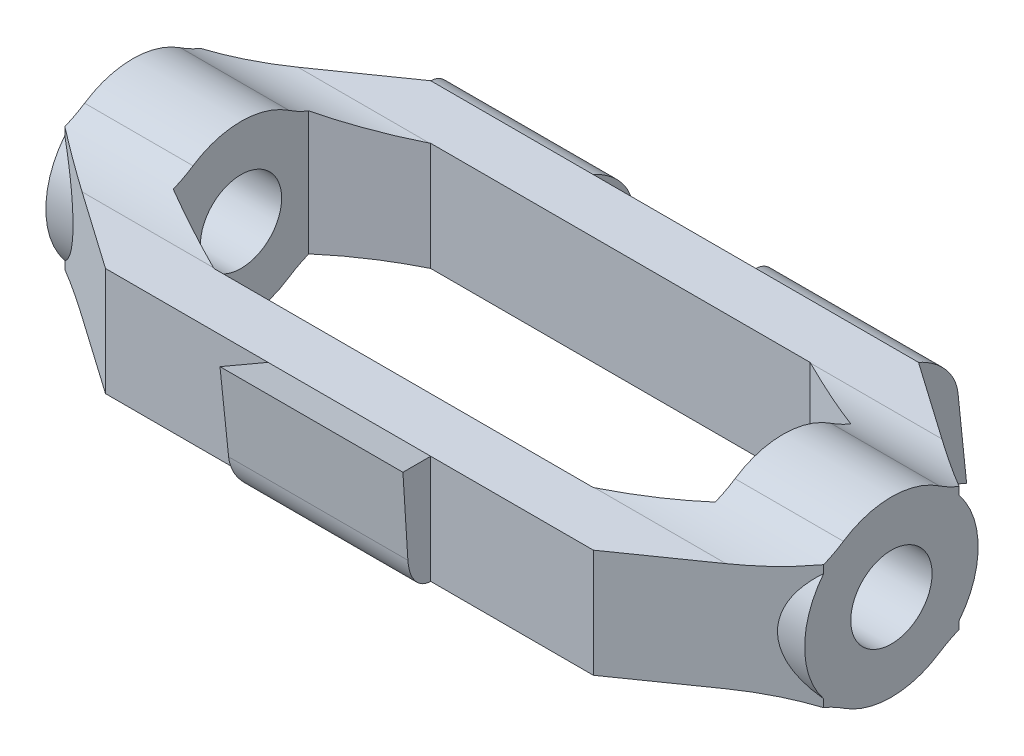
from build123d import *

# Parameters (mm, degrees)
RESSALTO_EXTRUS_O1_DEPTH           = 10
RESSALTO_EXTRUS_O1_2_DEPTH         = 10
ESBO_O2_R                          = 16.007810594
ESBO_O2_R_2                        = 7.5
RESSALTO_EXTRUS_O2_DEPTH           = 20
FILETE1_R                          = 20
ESBO_O3_W                          = 30
ESBO_O3_H                          = 20
RESSALTO_EXTRUS_O3_DEPTH           = 7
RESSALTO_EXTRUS_O3_DRAFT           = -15
ESBO_O4_W                          = 30
ESBO_O4_H                          = 20
RESSALTO_EXTRUS_O4_DEPTH           = 7
RESSALTO_EXTRUS_O4_DRAFT           = -15
RESSALTO_EXTRUS_O4_PROFILE_2_DEPTH = 7
RESSALTO_EXTRUS_O4_PROFILE_2_DRAFT = -15
CORTE_EXTRUS_O1_DEPTH              = 16.88
CORTE_EXTRUS_O2_DEPTH              = 46.88
FILETE4_R                          = 8


with BuildPart() as part:
    # Esboço1 → Ressalto-extrusão1 (new, symmetric)
    with BuildSketch(Plane(origin=(0, 0, 0), x_dir=(1, 0, 0), z_dir=(0, 1, 0))):
        Polygon((45, -30), (70, -12.5), (50, -12.5), (35, -20), (-35, -20), (-50, -12.5), (-70, -12.5), (-45, -30), align=None)
    extrude(amount=RESSALTO_EXTRUS_O1_DEPTH, both=True)



with BuildPart() as body_2:
    # Esboço1 → Ressalto-extrus_o1 2 (new, symmetric)
    with BuildSketch(Plane(origin=(0, 0, 0), x_dir=(1, 0, 0), z_dir=(0, 1, 0))):
        Polygon((70, 12.5), (50, 12.5), (35, 20), (-35, 20), (-50, 12.5), (-70, 12.5), (-45, 30), (45, 30), align=None)
    extrude(amount=RESSALTO_EXTRUS_O1_2_DEPTH, both=True)


with BuildPart() as part_1:
    add(part.part)

    add(body_2.part)  # Ressalto-extrusão2 merges body 2
    # Esboço2 → Ressalto-extrusão2 (add)
    with BuildSketch(Plane(origin=(-50, 0, 0), x_dir=(0, 0, -1), z_dir=(1, 0, 0))):
        Circle(ESBO_O2_R)
        Circle(ESBO_O2_R_2, mode=Mode.SUBTRACT)
    ressalto_extrus_o2 = extrude(amount=-RESSALTO_EXTRUS_O2_DEPTH)

    # Espelhar1: Ressalto-extrusão2 across plane
    add(ressalto_extrus_o2.mirror(Plane(origin=(0, 0, 0), x_dir=(0, 0, 1), z_dir=(1, 0, 0))))

    # Filete1
    # the kernel refuses this fillet: 20 mm, written as the material it adds along each edge
    with BuildSketch(Plane(origin=(70, -10, 12.5), x_dir=(0, 0, 1), z_dir=(-1, 0, 0))) as filete1_piece_1_section:
        with BuildLine():
            CenterArc((7.413875156, -20), FILETE1_R, 90, 33.576041437)
            ThreePointArc((-3.646989044, -3.336948565), (-1.693910252, -1.810098405), (0, 0))
            Line((0, 0), (7.413875156, 0))
        make_face()
    filete1_piece_1 = extrude(amount=20, mode=Mode.PRIVATE)
    filete1_piece_1 = split(filete1_piece_1, bisect_by=Plane(origin=(62.463989949, -10.639640977, 17.775207036), z_dir=(-0.5734623443633283, 0, -0.8192319205190406)), keep=Keep.TOP, mode=Mode.PRIVATE)
    filete1_piece_1 = split(filete1_piece_1, bisect_by=Plane(origin=(57.171735223, -10.639640977, 8.914132389), z_dir=(0.4472135954999588, 0, 0.8944271909999154)), keep=Keep.TOP, mode=Mode.PRIVATE)
    add(filete1_piece_1)
    with BuildSketch(Plane(origin=(70, -10, 12.5), x_dir=(0, 0, 1), z_dir=(-1, 0, 0))) as filete1_piece_2_section:
        with BuildLine():
            CenterArc((7.413875156, -20), FILETE1_R, 90, 33.576041437)
            ThreePointArc((-3.646989044, -3.336948565), (-1.693910252, -1.810098405), (0, 0))
            Line((0, 0), (7.413875156, 0))
        make_face()
    filete1_piece_2 = extrude(amount=20, mode=Mode.PRIVATE)
    filete1_piece_2 = split(filete1_piece_2, bisect_by=Plane(origin=(52.590686854, -12.043119704, 11.204656573), z_dir=(-0.4472135954999588, 0, -0.8944271909999154)), keep=Keep.TOP, mode=Mode.PRIVATE)
    add(filete1_piece_2)
    with BuildSketch(Plane(origin=(70, -10, 12.5), x_dir=(0, 0, 1), z_dir=(-1, 0, 0))) as filete1_piece_3_section:
        with BuildLine():
            CenterArc((7.413875156, -20), FILETE1_R, 90, 33.576041437)
            ThreePointArc((-3.646989044, -3.336948565), (-1.693910252, -1.810098405), (0, 0))
            Line((0, 0), (7.413875156, 0))
        make_face()
    filete1_piece_3 = extrude(amount=38.534687891, mode=Mode.PRIVATE)
    filete1_piece_3 = split(filete1_piece_3, bisect_by=Plane(origin=(44.945861579, -9.976895513, 15.027069211), z_dir=(0.4472135954999588, 0, 0.8944271909999154)), keep=Keep.TOP, mode=Mode.PRIVATE)
    filete1_piece_3 = split(filete1_piece_3, bisect_by=Plane(origin=(50, -9.976895513, 16.711782017), z_dir=(-1, 0, 0)), keep=Keep.TOP, mode=Mode.PRIVATE)
    add(filete1_piece_3)
    with BuildSketch(Plane(origin=(-31.465312109, 10, 12.5), x_dir=(0, 0.6750510749314106, -0.7377709985042425), z_dir=(-1, 0, 0))) as filete1_piece_4_section:
        with BuildLine():
            CenterArc((8.031279422, -19.760164364), FILETE1_R, 98.882075154, 33.576041437)
            Line((-5.469742077, -5.004744394), (0, 0))
            ThreePointArc((0, 0), (2.471626732, -0.191962172), (4.943253464, 0))
        make_face()
    filete1_piece_4 = extrude(amount=38.534687891, mode=Mode.PRIVATE)
    filete1_piece_4 = split(filete1_piece_4, bisect_by=Plane(origin=(-50, 9.976895512, 16.711782019), z_dir=(1, 0, 0)), keep=Keep.TOP, mode=Mode.PRIVATE)
    filete1_piece_4 = split(filete1_piece_4, bisect_by=Plane(origin=(-44.945861578, 9.976895512, 15.027069211), z_dir=(-0.4472135954999591, 0, 0.8944271909999153)), keep=Keep.TOP, mode=Mode.PRIVATE)
    add(filete1_piece_4)
    with BuildSketch(Plane(origin=(-50, 10, 12.5), x_dir=(0, 0.6750510749314104, -0.7377709985042427), z_dir=(-1, 0, 0))) as filete1_piece_5_section:
        with BuildLine():
            CenterArc((8.031279422, -19.760164364), FILETE1_R, 98.882075154, 33.576041437)
            Line((-5.469742077, -5.004744394), (0, 0))
            ThreePointArc((0, 0), (2.471626732, -0.191962172), (4.943253464, 0))
        make_face()
    filete1_piece_5 = extrude(amount=20, mode=Mode.PRIVATE)
    filete1_piece_5 = split(filete1_piece_5, bisect_by=Plane(origin=(-52.590686846, 12.043119705, 11.204656577), z_dir=(0.4472135954999591, 0, -0.8944271909999153)), keep=Keep.TOP, mode=Mode.PRIVATE)
    add(filete1_piece_5)
    with BuildSketch(Plane(origin=(-50, 10, 12.5), x_dir=(0, 0.6750510749314104, -0.7377709985042427), z_dir=(-1, 0, 0))) as filete1_piece_6_section:
        with BuildLine():
            CenterArc((8.031279422, -19.760164364), FILETE1_R, 98.882075154, 33.576041437)
            Line((-5.469742077, -5.004744394), (0, 0))
            ThreePointArc((0, 0), (2.471626732, -0.191962172), (4.943253464, 0))
        make_face()
    filete1_piece_6 = extrude(amount=20, mode=Mode.PRIVATE)
    filete1_piece_6 = split(filete1_piece_6, bisect_by=Plane(origin=(-62.463989948, 10.639640977, 17.775207036), z_dir=(0.5734623443633283, 0, -0.8192319205190406)), keep=Keep.TOP, mode=Mode.PRIVATE)
    filete1_piece_6 = split(filete1_piece_6, bisect_by=Plane(origin=(-57.171735222, 10.639640977, 8.914132389), z_dir=(-0.4472135954999591, 0, 0.8944271909999153)), keep=Keep.TOP, mode=Mode.PRIVATE)
    add(filete1_piece_6)
    with BuildSketch(Plane(origin=(70, 10, -12.5), x_dir=(0, 0.67505107493141, 0.737770998504243), z_dir=(-1, 0, 0))) as filete1_piece_7_section:
        with BuildLine():
            CenterArc((8.031279422, 19.760164364), FILETE1_R, 227.541883409, 33.576041437)
            Line((-5.469742077, 5.004744394), (0, 0))
            ThreePointArc((0, 0), (2.471626732, 0.191962172), (4.943253464, 0))
        make_face()
    filete1_piece_7 = extrude(amount=20, mode=Mode.PRIVATE)
    filete1_piece_7 = split(filete1_piece_7, bisect_by=Plane(origin=(57.171735222, 10.639640977, -8.914132389), z_dir=(0.44721359549995815, 0, -0.8944271909999159)), keep=Keep.TOP, mode=Mode.PRIVATE)
    filete1_piece_7 = split(filete1_piece_7, bisect_by=Plane(origin=(62.463989948, 10.639640977, -17.775207036), z_dir=(-0.5734623443633284, 0, 0.8192319205190405)), keep=Keep.TOP, mode=Mode.PRIVATE)
    add(filete1_piece_7)
    with BuildSketch(Plane(origin=(70, 10, -12.5), x_dir=(0, 0.67505107493141, 0.737770998504243), z_dir=(-1, 0, 0))) as filete1_piece_8_section:
        with BuildLine():
            CenterArc((8.031279422, 19.760164364), FILETE1_R, 227.541883409, 33.576041437)
            Line((-5.469742077, 5.004744394), (0, 0))
            ThreePointArc((0, 0), (2.471626732, 0.191962172), (4.943253464, 0))
        make_face()
    filete1_piece_8 = extrude(amount=38.534687891, mode=Mode.PRIVATE)
    filete1_piece_8 = split(filete1_piece_8, bisect_by=Plane(origin=(44.945861578, 9.976895512, -15.027069211), z_dir=(0.44721359549995815, 0, -0.8944271909999159)), keep=Keep.TOP, mode=Mode.PRIVATE)
    filete1_piece_8 = split(filete1_piece_8, bisect_by=Plane(origin=(50, 9.976895512, -16.711782019), z_dir=(-1, 0, 0)), keep=Keep.TOP, mode=Mode.PRIVATE)
    add(filete1_piece_8)
    with BuildSketch(Plane(origin=(70, 10, -12.5), x_dir=(0, 0.67505107493141, 0.737770998504243), z_dir=(-1, 0, 0))) as filete1_piece_9_section:
        with BuildLine():
            CenterArc((8.031279422, 19.760164364), FILETE1_R, 227.541883409, 33.576041437)
            Line((-5.469742077, 5.004744394), (0, 0))
            ThreePointArc((0, 0), (2.471626732, 0.191962172), (4.943253464, 0))
        make_face()
    filete1_piece_9 = extrude(amount=20, mode=Mode.PRIVATE)
    filete1_piece_9 = split(filete1_piece_9, bisect_by=Plane(origin=(52.590686846, 12.043119705, -11.204656577), z_dir=(-0.44721359549995815, 0, 0.8944271909999159)), keep=Keep.TOP, mode=Mode.PRIVATE)
    add(filete1_piece_9)
    with BuildSketch(Plane(origin=(-50, 10, -12.5), x_dir=(0, 0, -1), z_dir=(-1, 0, 0))) as filete1_piece_10_section:
        with BuildLine():
            CenterArc((7.413875156, -20), FILETE1_R, 90, 33.576041437)
            ThreePointArc((-3.646989044, -3.336948565), (-1.693910252, -1.810098405), (0, 0))
            Line((0, 0), (7.413875156, 0))
        make_face()
    filete1_piece_10 = extrude(amount=20, mode=Mode.PRIVATE)
    filete1_piece_10 = split(filete1_piece_10, bisect_by=Plane(origin=(-52.590686854, 12.043119704, -11.204656573), z_dir=(0.44721359549995776, 0, 0.894427190999916)), keep=Keep.TOP, mode=Mode.PRIVATE)
    add(filete1_piece_10)
    with BuildSketch(Plane(origin=(-31.465312109, 10, -12.5), x_dir=(0, 0, -1), z_dir=(-1, 0, 0))) as filete1_piece_11_section:
        with BuildLine():
            CenterArc((7.413875156, -20), FILETE1_R, 90, 33.576041437)
            ThreePointArc((-3.646989044, -3.336948565), (-1.693910252, -1.810098405), (0, 0))
            Line((0, 0), (7.413875156, 0))
        make_face()
    filete1_piece_11 = extrude(amount=38.534687891, mode=Mode.PRIVATE)
    filete1_piece_11 = split(filete1_piece_11, bisect_by=Plane(origin=(-50, 9.976895513, -16.711782017), z_dir=(1, 0, 0)), keep=Keep.TOP, mode=Mode.PRIVATE)
    filete1_piece_11 = split(filete1_piece_11, bisect_by=Plane(origin=(-44.945861579, 9.976895513, -15.027069211), z_dir=(-0.44721359549995776, 0, -0.894427190999916)), keep=Keep.TOP, mode=Mode.PRIVATE)
    add(filete1_piece_11)
    with BuildSketch(Plane(origin=(-50, 10, -12.5), x_dir=(0, 0, -1), z_dir=(-1, 0, 0))) as filete1_piece_12_section:
        with BuildLine():
            CenterArc((7.413875156, -20), FILETE1_R, 90, 33.576041437)
            ThreePointArc((-3.646989044, -3.336948565), (-1.693910252, -1.810098405), (0, 0))
            Line((0, 0), (7.413875156, 0))
        make_face()
    filete1_piece_12 = extrude(amount=20, mode=Mode.PRIVATE)
    filete1_piece_12 = split(filete1_piece_12, bisect_by=Plane(origin=(-57.171735223, 10.639640977, -8.914132389), z_dir=(-0.44721359549995776, 0, -0.894427190999916)), keep=Keep.TOP, mode=Mode.PRIVATE)
    filete1_piece_12 = split(filete1_piece_12, bisect_by=Plane(origin=(-62.463989949, 10.639640977, -17.775207036), z_dir=(0.5734623443633284, 0, 0.8192319205190404)), keep=Keep.TOP, mode=Mode.PRIVATE)
    add(filete1_piece_12)
    with BuildSketch(Plane(origin=(70, -10, -12.5), x_dir=(0, 0, -1), z_dir=(-1, 0, 0))) as filete1_piece_13_section:
        with BuildLine():
            CenterArc((7.413875156, 20), FILETE1_R, 236.423958563, 33.576041437)
            ThreePointArc((-3.646989044, 3.336948565), (-1.693910252, 1.810098405), (0, 0))
            Line((0, 0), (7.413875156, 0))
        make_face()
    filete1_piece_13 = extrude(amount=20, mode=Mode.PRIVATE)
    filete1_piece_13 = split(filete1_piece_13, bisect_by=Plane(origin=(57.171735223, -10.639640977, -8.914132389), z_dir=(0.44721359549995815, 0, -0.8944271909999159)), keep=Keep.TOP, mode=Mode.PRIVATE)
    filete1_piece_13 = split(filete1_piece_13, bisect_by=Plane(origin=(62.463989949, -10.639640977, -17.775207036), z_dir=(-0.5734623443633284, 0, 0.8192319205190405)), keep=Keep.TOP, mode=Mode.PRIVATE)
    add(filete1_piece_13)
    with BuildSketch(Plane(origin=(70, -10, -12.5), x_dir=(0, 0, -1), z_dir=(-1, 0, 0))) as filete1_piece_14_section:
        with BuildLine():
            CenterArc((7.413875156, 20), FILETE1_R, 236.423958563, 33.576041437)
            ThreePointArc((-3.646989044, 3.336948565), (-1.693910252, 1.810098405), (0, 0))
            Line((0, 0), (7.413875156, 0))
        make_face()
    filete1_piece_14 = extrude(amount=20, mode=Mode.PRIVATE)
    filete1_piece_14 = split(filete1_piece_14, bisect_by=Plane(origin=(52.590686854, -12.043119704, -11.204656573), z_dir=(-0.44721359549995815, 0, 0.8944271909999159)), keep=Keep.TOP, mode=Mode.PRIVATE)
    add(filete1_piece_14)
    with BuildSketch(Plane(origin=(70, -10, -12.5), x_dir=(0, 0, -1), z_dir=(-1, 0, 0))) as filete1_piece_15_section:
        with BuildLine():
            CenterArc((7.413875156, 20), FILETE1_R, 236.423958563, 33.576041437)
            ThreePointArc((-3.646989044, 3.336948565), (-1.693910252, 1.810098405), (0, 0))
            Line((0, 0), (7.413875156, 0))
        make_face()
    filete1_piece_15 = extrude(amount=38.534687891, mode=Mode.PRIVATE)
    filete1_piece_15 = split(filete1_piece_15, bisect_by=Plane(origin=(44.945861579, -9.976895513, -15.027069211), z_dir=(0.44721359549995815, 0, -0.8944271909999159)), keep=Keep.TOP, mode=Mode.PRIVATE)
    filete1_piece_15 = split(filete1_piece_15, bisect_by=Plane(origin=(50, -9.976895513, -16.711782017), z_dir=(-1, 0, 0)), keep=Keep.TOP, mode=Mode.PRIVATE)
    add(filete1_piece_15)
    with BuildSketch(Plane(origin=(-50, -10, -12.5), x_dir=(0, 0, -1), z_dir=(-1, 0, 0))) as filete1_piece_16_section:
        with BuildLine():
            CenterArc((7.413875156, 20), FILETE1_R, 236.423958563, 33.576041437)
            ThreePointArc((-3.646989044, 3.336948565), (-1.693910252, 1.810098405), (0, 0))
            Line((0, 0), (7.413875156, 0))
        make_face()
    filete1_piece_16 = extrude(amount=20, mode=Mode.PRIVATE)
    filete1_piece_16 = split(filete1_piece_16, bisect_by=Plane(origin=(-52.590686854, -12.043119704, -11.204656573), z_dir=(0.44721359549995776, 0, 0.894427190999916)), keep=Keep.TOP, mode=Mode.PRIVATE)
    add(filete1_piece_16)
    with BuildSketch(Plane(origin=(-31.465312109, -10, -12.5), x_dir=(0, 0, -1), z_dir=(-1, 0, 0))) as filete1_piece_17_section:
        with BuildLine():
            CenterArc((7.413875156, 20), FILETE1_R, 236.423958563, 33.576041437)
            ThreePointArc((-3.646989044, 3.336948565), (-1.693910252, 1.810098405), (0, 0))
            Line((0, 0), (7.413875156, 0))
        make_face()
    filete1_piece_17 = extrude(amount=38.534687891, mode=Mode.PRIVATE)
    filete1_piece_17 = split(filete1_piece_17, bisect_by=Plane(origin=(-50, -9.976895513, -16.711782017), z_dir=(1, 0, 0)), keep=Keep.TOP, mode=Mode.PRIVATE)
    filete1_piece_17 = split(filete1_piece_17, bisect_by=Plane(origin=(-44.945861579, -9.976895513, -15.027069211), z_dir=(-0.44721359549995776, 0, -0.894427190999916)), keep=Keep.TOP, mode=Mode.PRIVATE)
    add(filete1_piece_17)
    with BuildSketch(Plane(origin=(-50, -10, -12.5), x_dir=(0, 0, -1), z_dir=(-1, 0, 0))) as filete1_piece_18_section:
        with BuildLine():
            CenterArc((7.413875156, 20), FILETE1_R, 236.423958563, 33.576041437)
            ThreePointArc((-3.646989044, 3.336948565), (-1.693910252, 1.810098405), (0, 0))
            Line((0, 0), (7.413875156, 0))
        make_face()
    filete1_piece_18 = extrude(amount=20, mode=Mode.PRIVATE)
    filete1_piece_18 = split(filete1_piece_18, bisect_by=Plane(origin=(-57.171735223, -10.639640977, -8.914132389), z_dir=(-0.44721359549995776, 0, -0.894427190999916)), keep=Keep.TOP, mode=Mode.PRIVATE)
    filete1_piece_18 = split(filete1_piece_18, bisect_by=Plane(origin=(-62.463989949, -10.639640977, -17.775207036), z_dir=(0.5734623443633284, 0, 0.8192319205190404)), keep=Keep.TOP, mode=Mode.PRIVATE)
    add(filete1_piece_18)
    with BuildSketch(Plane(origin=(70, 10, 12.5), x_dir=(0, 0.6750510749314104, -0.7377709985042427), z_dir=(-1, 0, 0))) as filete1_piece_19_section:
        with BuildLine():
            CenterArc((8.031279422, -19.760164364), FILETE1_R, 98.882075154, 33.576041437)
            Line((-5.469742077, -5.004744394), (0, 0))
            ThreePointArc((0, 0), (2.471626732, -0.191962172), (4.943253464, 0))
        make_face()
    filete1_piece_19 = extrude(amount=20, mode=Mode.PRIVATE)
    filete1_piece_19 = split(filete1_piece_19, bisect_by=Plane(origin=(62.463989948, 10.639640977, 17.775207036), z_dir=(-0.5734623443633283, 0, -0.8192319205190406)), keep=Keep.TOP, mode=Mode.PRIVATE)
    filete1_piece_19 = split(filete1_piece_19, bisect_by=Plane(origin=(57.171735222, 10.639640977, 8.914132389), z_dir=(0.4472135954999588, 0, 0.8944271909999154)), keep=Keep.TOP, mode=Mode.PRIVATE)
    add(filete1_piece_19)
    with BuildSketch(Plane(origin=(70, 10, 12.5), x_dir=(0, 0.6750510749314104, -0.7377709985042427), z_dir=(-1, 0, 0))) as filete1_piece_20_section:
        with BuildLine():
            CenterArc((8.031279422, -19.760164364), FILETE1_R, 98.882075154, 33.576041437)
            Line((-5.469742077, -5.004744394), (0, 0))
            ThreePointArc((0, 0), (2.471626732, -0.191962172), (4.943253464, 0))
        make_face()
    filete1_piece_20 = extrude(amount=38.534687891, mode=Mode.PRIVATE)
    filete1_piece_20 = split(filete1_piece_20, bisect_by=Plane(origin=(50, 9.976895512, 16.711782019), z_dir=(-1, 0, 0)), keep=Keep.TOP, mode=Mode.PRIVATE)
    filete1_piece_20 = split(filete1_piece_20, bisect_by=Plane(origin=(44.945861578, 9.976895512, 15.027069211), z_dir=(0.4472135954999588, 0, 0.8944271909999154)), keep=Keep.TOP, mode=Mode.PRIVATE)
    add(filete1_piece_20)
    with BuildSketch(Plane(origin=(70, 10, 12.5), x_dir=(0, 0.6750510749314104, -0.7377709985042427), z_dir=(-1, 0, 0))) as filete1_piece_21_section:
        with BuildLine():
            CenterArc((8.031279422, -19.760164364), FILETE1_R, 98.882075154, 33.576041437)
            Line((-5.469742077, -5.004744394), (0, 0))
            ThreePointArc((0, 0), (2.471626732, -0.191962172), (4.943253464, 0))
        make_face()
    filete1_piece_21 = extrude(amount=20, mode=Mode.PRIVATE)
    filete1_piece_21 = split(filete1_piece_21, bisect_by=Plane(origin=(52.590686846, 12.043119705, 11.204656577), z_dir=(-0.4472135954999588, 0, -0.8944271909999154)), keep=Keep.TOP, mode=Mode.PRIVATE)
    add(filete1_piece_21)
    with BuildSketch(Plane(origin=(-50, -10, 12.5), x_dir=(0, 0, 1), z_dir=(-1, 0, 0))) as filete1_piece_22_section:
        with BuildLine():
            CenterArc((7.413875156, -20), FILETE1_R, 90, 33.576041437)
            ThreePointArc((-3.646989044, -3.336948565), (-1.693910252, -1.810098405), (0, 0))
            Line((0, 0), (7.413875156, 0))
        make_face()
    filete1_piece_22 = extrude(amount=20, mode=Mode.PRIVATE)
    filete1_piece_22 = split(filete1_piece_22, bisect_by=Plane(origin=(-52.590686854, -12.043119704, 11.204656573), z_dir=(0.4472135954999591, 0, -0.8944271909999153)), keep=Keep.TOP, mode=Mode.PRIVATE)
    add(filete1_piece_22)
    with BuildSketch(Plane(origin=(-31.465312109, -10, 12.5), x_dir=(0, 0, 1), z_dir=(-1, 0, 0))) as filete1_piece_23_section:
        with BuildLine():
            CenterArc((7.413875156, -20), FILETE1_R, 90, 33.576041437)
            ThreePointArc((-3.646989044, -3.336948565), (-1.693910252, -1.810098405), (0, 0))
            Line((0, 0), (7.413875156, 0))
        make_face()
    filete1_piece_23 = extrude(amount=38.534687891, mode=Mode.PRIVATE)
    filete1_piece_23 = split(filete1_piece_23, bisect_by=Plane(origin=(-44.945861579, -9.976895513, 15.027069211), z_dir=(-0.4472135954999591, 0, 0.8944271909999153)), keep=Keep.TOP, mode=Mode.PRIVATE)
    filete1_piece_23 = split(filete1_piece_23, bisect_by=Plane(origin=(-50, -9.976895513, 16.711782017), z_dir=(1, 0, 0)), keep=Keep.TOP, mode=Mode.PRIVATE)
    add(filete1_piece_23)
    with BuildSketch(Plane(origin=(-50, -10, 12.5), x_dir=(0, 0, 1), z_dir=(-1, 0, 0))) as filete1_piece_24_section:
        with BuildLine():
            CenterArc((7.413875156, -20), FILETE1_R, 90, 33.576041437)
            ThreePointArc((-3.646989044, -3.336948565), (-1.693910252, -1.810098405), (0, 0))
            Line((0, 0), (7.413875156, 0))
        make_face()
    filete1_piece_24 = extrude(amount=20, mode=Mode.PRIVATE)
    filete1_piece_24 = split(filete1_piece_24, bisect_by=Plane(origin=(-57.171735223, -10.639640977, 8.914132389), z_dir=(-0.4472135954999591, 0, 0.8944271909999153)), keep=Keep.TOP, mode=Mode.PRIVATE)
    filete1_piece_24 = split(filete1_piece_24, bisect_by=Plane(origin=(-62.463989949, -10.639640977, 17.775207036), z_dir=(0.5734623443633283, 0, -0.8192319205190406)), keep=Keep.TOP, mode=Mode.PRIVATE)
    add(filete1_piece_24)


with BuildPart() as ressalto_extrus_o3_tool:
    # Esboço3 → Ressalto-extrusão3 (with draft: the straight prism first)
    with BuildSketch(Plane.XY.offset(30)):
        Rectangle(ESBO_O3_W, ESBO_O3_H)
    extrude(amount=RESSALTO_EXTRUS_O3_DEPTH)
    # Ressalto-extrusão3: the draft: its side faces are tilted about the plane it starts from
    ressalto_extrus_o3_sides = [ressalto_extrus_o3_tool.faces().sort_by_distance(p)[0] for p in [
        (0, -10, 33.5),
        (15, 0, 33.5),
        (0, 10, 33.5),
        (-15, 0, 33.5),
    ]]
    draft(ressalto_extrus_o3_sides, Plane.XY.offset(30), RESSALTO_EXTRUS_O3_DRAFT)


with BuildPart() as part_2:
    add(part_1.part)

    # Ressalto-extrusão3: add ressalto_extrus_o3_tool
    add(ressalto_extrus_o3_tool.part)


with BuildPart() as ressalto_extrus_o4_tool:
    # Esboço4 → Ressalto-extrusão4 (with draft: the straight prism first)
    with BuildSketch(Plane(origin=(0, 0, -30), x_dir=(-1, 0, 0), z_dir=(0, 0, -1))):
        with Locations((-30, 0)):
            Rectangle(ESBO_O4_W, ESBO_O4_H)
    extrude(amount=RESSALTO_EXTRUS_O4_DEPTH)
    # Ressalto-extrusão4: the draft: its side faces are tilted about the plane it starts from
    ressalto_extrus_o4_sides = [ressalto_extrus_o4_tool.faces().sort_by_distance(p)[0] for p in [
        (45, 0, -33.5),
        (30, -10, -33.5),
        (15, 0, -33.5),
        (30, 10, -33.5),
    ]]
    draft(ressalto_extrus_o4_sides, Plane(origin=(0, 0, -30), x_dir=(-1, 0, 0), z_dir=(0, 0, -1)), RESSALTO_EXTRUS_O4_DRAFT)


with BuildPart() as part_3:
    add(part_2.part)

    # Ressalto-extrusão4: add ressalto_extrus_o4_tool
    add(ressalto_extrus_o4_tool.part)


with BuildPart() as ressalto_extrus_o4_profile_2_tool:
    # Esboço4 → Ressalto-extrusão4 profile 2 (with draft: the straight prism first)
    with BuildSketch(Plane(origin=(0, 0, -30), x_dir=(-1, 0, 0), z_dir=(0, 0, -1))):
        with Locations((30, 0)):
            Rectangle(ESBO_O4_W, ESBO_O4_H)
    extrude(amount=RESSALTO_EXTRUS_O4_PROFILE_2_DEPTH)
    # Ressalto-extrusão4 profile 2: the draft: its side faces are tilted about the plane it starts from
    ressalto_extrus_o4_profile_2_sides = [ressalto_extrus_o4_profile_2_tool.faces().sort_by_distance(p)[0] for p in [
        (-15, 0, -33.5),
        (-30, -10, -33.5),
        (-45, 0, -33.5),
        (-30, 10, -33.5),
    ]]
    draft(ressalto_extrus_o4_profile_2_sides, Plane(origin=(0, 0, -30), x_dir=(-1, 0, 0), z_dir=(0, 0, -1)), RESSALTO_EXTRUS_O4_PROFILE_2_DRAFT)


with BuildPart() as part_4:
    add(part_3.part)

    # Ressalto-extrusão4 profile 2: add ressalto_extrus_o4_profile_2_tool
    add(ressalto_extrus_o4_profile_2_tool.part)

    # Esboço8 → Corte-extrusão1 (cut, symmetric)
    with BuildSketch(Plane(origin=(0, 0, 0), x_dir=(0, 0, -1), z_dir=(1, 0, 0))):
        Polygon((-37, 11.875644347), (-35.044130132, -11.351570595), (-37, -11.875644347), align=None)
    extrude(amount=CORTE_EXTRUS_O1_DEPTH, both=True, mode=Mode.SUBTRACT)

    # Esboço7 → Corte-extrusão2 (cut, symmetric)
    with BuildSketch(Plane(origin=(0, 0, 0), x_dir=(0, 0, -1), z_dir=(1, 0, 0))):
        Polygon((37, 11.875644347), (37, -11.875644347), (35.044130132, 11.351570595), align=None)
    extrude(amount=CORTE_EXTRUS_O2_DEPTH, both=True, mode=Mode.SUBTRACT)

    # Filete4
    # the kernel refuses this fillet: 8 mm, written as the material it takes off along each edge
    with BuildSketch(Plane(origin=(37.338485297, -11.351570595, 35.044130132), x_dir=(0, 0.2588190451025217, -0.965925826289068), z_dir=(-1, 0, 0))) as filete4_piece_1:
        with BuildLine():
            CenterArc((9.358561612, -6.847584884), FILETE4_R, 121.135363687, 69.051345366)
            Line((1.484668332, -8.262436332), (1.327190466, -8.290733361))
            Line((1.327190466, -8.290733361), (-0.157477866, -0.028297029))
            Line((-0.157477866, -0.028297029), (0, 0.16))
            ThreePointArc((0, 0.16), (2.611033888, 0.16), (5.1393379, 0.136951698))
            Line((5.1393379, 0.136951698), (5.222067776, 0))
        make_face()
    extrude(amount=74.676970595, mode=Mode.SUBTRACT)
    with BuildSketch(Plane(origin=(-7.338485297, 11.351570595, -35.044130132), x_dir=(0, -0.2588190451025215, 0.9659258262890681), z_dir=(1, 0, 0)), Plane(origin=(-67.338485297, 11.351570595, -35.044130132), x_dir=(0, -0.25881904510252435, 0.9659258262890673), z_dir=(1, 0, 0))) as filete4_piece_2:
        with BuildLine():
            CenterArc((9.358561612, 6.847584884), FILETE4_R, 169.813290948, 69.051345365)
            Line((1.484668332, 8.262436332), (1.327190466, 8.290733361))
            Line((1.327190466, 8.290733361), (-0.157477866, 0.028297029))
            Line((-0.157477866, 0.028297029), (0, -0.16))
            ThreePointArc((0, -0.16), (2.611033888, -0.16), (5.1393379, -0.136951698))
            Line((5.1393379, -0.136951698), (5.222067776, 0))
        make_face()
    extrude(amount=74.676970594, mode=Mode.SUBTRACT)


solid = part_4.part
